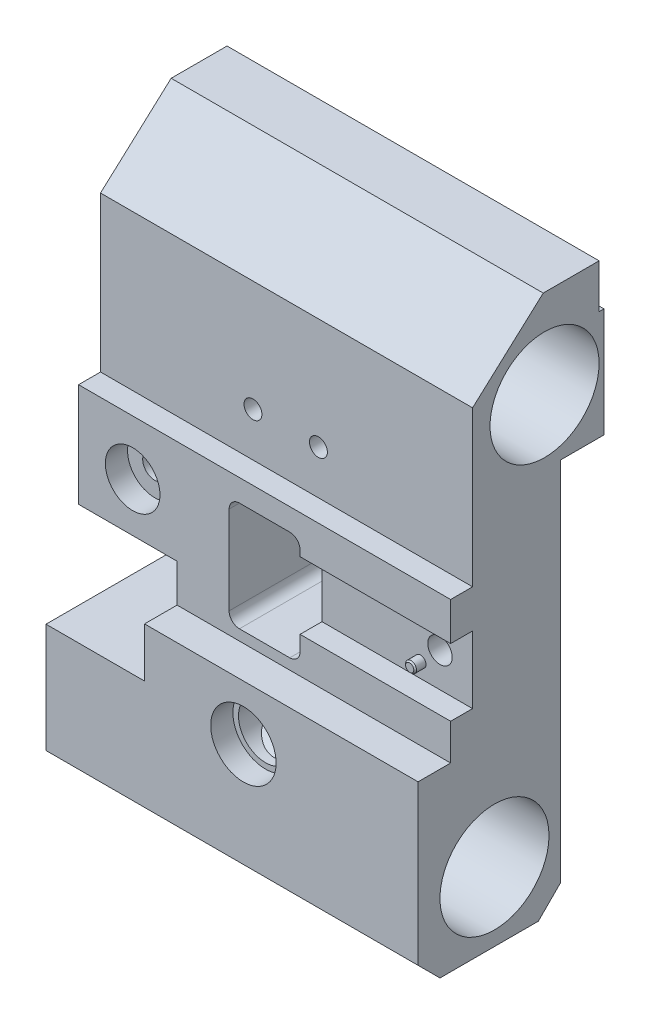
from build123d import *

# Parameters (mm, degrees)
BOSS_EXTRUDE1_DEPTH      = 54
BOSS_EXTRUDE1_DEPTH_BACK = 54
SKETCH1_R                = 15.83
SKETCH2_R                = 7.875
SKETCH2_R_2              = 2.6
SKETCH2_R_3              = 3.525
SKETCH2_R_4              = 3.55
SKETCH2_W                = 28.6
SKETCH2_H                = 25.4
CUT_EXTRUDE1_DEPTH       = 154.113939274
SKETCH3_W                = 43.7
SKETCH3_H                = 19.52
CUT_EXTRUDE2_DEPTH       = 6.36
SKETCH4_R                = 1.585
BOSS_EXTRUDE2_DEPTH      = 3.15
SKETCH10_R               = 1.585
CUT_EXTRUDE6_DEPTH       = 20
SKETCH11_R               = 5.5
SKETCH11_R_2             = 3.525
SKETCH11_R_3             = 5.42
CUT_EXTRUDE7_DEPTH       = 6.56
CHAMFER1_SIZE            = 0.4
SKETCH5_R                = 7.925
CUT_EXTRUDE3_DEPTH       = 6.44
SKETCH6_R                = 9.495
CUT_EXTRUDE4_DEPTH       = 6.44
SKETCH7_W                = 8.77
SKETCH7_H                = 34.96
BOSS_EXTRUDE3_DEPTH      = 3.1
SKETCH8_R                = 2
CUT_EXTRUDE5_DEPTH       = 15
SKETCH11_3_R             = 4.55
SKETCH11_3_R_2           = 2.6
CUT_EXTRUDE8_DEPTH       = 5.45
SKETCH12_R               = 9.475
CUT_EXTRUDE9_DEPTH       = 5.15
SKETCH13_R               = 2
CUT_EXTRUDE10_DEPTH      = 10
SKETCH14_R               = 2
CUT_EXTRUDE11_DEPTH      = 10


with BuildPart() as part:
    # Sketch1 → Boss-Extrude1 (new, two sides: drawn at the far end of the back side and taken through both)
    with BuildSketch(Plane(origin=(0, 0, 0), x_dir=(0, 0, -1), z_dir=(1, 0, 0)).offset(-BOSS_EXTRUDE1_DEPTH_BACK)):
        Polygon((14.15, 137.2), (30.37, 137.2), (30.37, 124.41), (31.79, 124.41), (31.79, 92.72), (19.1, 92.72), (19.1, -13.636038969), (12.736038969, -20), (-15.816038969, -20), (-22.18, -13.636038969), (-22.18, 32.5), (-12.73, 32.5), (-12.73, 73.61), (-6.36, 73.61), (-6.36, 118.61), align=None)
        Circle(SKETCH1_R, mode=Mode.SUBTRACT)
        with Locations((14.54, 111.46)):
            Circle(SKETCH1_R, mode=Mode.SUBTRACT)
    extrude(amount=BOSS_EXTRUDE1_DEPTH + BOSS_EXTRUDE1_DEPTH_BACK)

    # Sketch2 → Cut-Extrude1 (cut, through all)
    with BuildSketch(Plane(origin=(0, 0, -19.1), x_dir=(-1, 0, 0), z_dir=(0, 0, -1))):
        with Locations((-3.3, 16.595)):
            Circle(SKETCH2_R)
        with Locations((-9.25, 86.37)):
            Circle(SKETCH2_R_2)
        with Locations((9.75, 86.37)):
            Circle(SKETCH2_R_2)
        with Locations((38.3, 57.72)):
            Circle(SKETCH2_R_3)
        with Locations((-44.55, 52.92)):
            Circle(SKETCH2_R_4)
        with BuildLine():
            Line((-7.3, 67.2), (7.3, 67.2))
            ThreePointArc((7.3, 67.2), (9.421320344, 66.321320344), (10.3, 64.2))
            Line((10.3, 64.2), (10.3, 38.6))
            ThreePointArc((10.3, 38.6), (9.421320344, 36.478679656), (7.3, 35.6))
            Line((7.3, 35.6), (-7.3, 35.6))
            ThreePointArc((-7.3, 35.6), (-9.421320344, 36.478679656), (-10.3, 38.6))
            Line((-10.3, 38.6), (-10.3, 64.2))
            ThreePointArc((-10.3, 64.2), (-9.421320344, 66.321320344), (-7.3, 67.2))
        make_face()
        with Locations((39.7, 30.83)):
            Rectangle(SKETCH2_W, SKETCH2_H)
    extrude(amount=-CUT_EXTRUDE1_DEPTH, mode=Mode.SUBTRACT)

    # Sketch3 → Cut-Extrude2 (cut)
    with BuildSketch(Plane.XY.offset(12.73)):
        with Locations((32.15, 52.76)):
            Rectangle(SKETCH3_W, SKETCH3_H)
    extrude(amount=-CUT_EXTRUDE2_DEPTH, mode=Mode.SUBTRACT)

    # Sketch4 → Boss-Extrude2 (add)
    with BuildSketch(Plane.XY.offset(6.37)):
        with Locations((38.915, 47.335)):
            Circle(SKETCH4_R)
    extrude(amount=BOSS_EXTRUDE2_DEPTH)

    # Sketch10 → Cut-Extrude6 (cut)
    with BuildSketch(Plane(origin=(0, 0, -19.1), x_dir=(-1, 0, 0), z_dir=(0, 0, -1))):
        with Locations((-38.915, 47.335)):
            Circle(SKETCH10_R)
    extrude(amount=-CUT_EXTRUDE6_DEPTH, mode=Mode.SUBTRACT)

    # Sketch11 → Cut-Extrude7 (cut)
    # profile 1 of 2: a face of its own
    with BuildSketch(Plane(origin=(0, 0, -19.1), x_dir=(-1, 0, 0), z_dir=(0, 0, -1))):
        with Locations((38.3, 57.72)):
            Circle(SKETCH11_R)
        with Locations((38.3, 57.72)):
            Circle(SKETCH11_R_2, mode=Mode.SUBTRACT)
    # profile 2 of 2: a face of its own
    with BuildSketch(Plane(origin=(0, 0, -19.1), x_dir=(-1, 0, 0), z_dir=(0, 0, -1))):
        with Locations((-44.55, 52.92)):
            Circle(SKETCH11_R_3)
    extrude(amount=-CUT_EXTRUDE7_DEPTH, mode=Mode.SUBTRACT)

    # Chamfer1
    chamfer1_edges = [part.edges().sort_by_distance(p)[0] for p in [
        (37.33, 47.335, 9.52),
    ]]
    chamfer(chamfer1_edges, length=CHAMFER1_SIZE)

    # Sketch5 → Cut-Extrude3 (cut)
    with BuildSketch(Plane.XY.offset(12.73)):
        with Locations((-38.3, 57.72)):
            Circle(SKETCH5_R)
    extrude(amount=-CUT_EXTRUDE3_DEPTH, mode=Mode.SUBTRACT)

    # Sketch6 → Cut-Extrude4 (cut)
    with BuildSketch(Plane.XY.offset(22.18)):
        with Locations((3.3, 16.595)):
            Circle(SKETCH6_R)
    extrude(amount=-CUT_EXTRUDE4_DEPTH, mode=Mode.SUBTRACT)

    # Sketch7 → Boss-Extrude3 (add)
    with BuildSketch(Plane(origin=(0, 0, -19.1), x_dir=(-1, 0, 0), z_dir=(0, 0, -1))):
        with Locations((21.015, 16.59)):
            Rectangle(SKETCH7_W, SKETCH7_H)
    extrude(amount=BOSS_EXTRUDE3_DEPTH)

    # Sketch8 → Cut-Extrude5 (cut)
    with BuildSketch(Plane(origin=(0, 0, -22.2), x_dir=(-1, 0, 0), z_dir=(0, 0, -1))):
        with Locations((21.4, 29.135)):
            Circle(SKETCH8_R)
        with Locations((21.4, 3.82)):
            Circle(SKETCH8_R)
    extrude(amount=-CUT_EXTRUDE5_DEPTH, mode=Mode.SUBTRACT)

    # Sketch11<3> → Cut-Extrude8 (cut)
    # profile 1 of 2: a face of its own
    with BuildSketch(Plane(origin=(0, 0, -19.1), x_dir=(-1, 0, 0), z_dir=(0, 0, -1))):
        with Locations((-9.25, 86.37)):
            Circle(SKETCH11_3_R)
        with Locations((-9.25, 86.37)):
            Circle(SKETCH11_3_R_2, mode=Mode.SUBTRACT)
    # profile 2 of 2: a face of its own
    with BuildSketch(Plane(origin=(0, 0, -19.1), x_dir=(-1, 0, 0), z_dir=(0, 0, -1))):
        with Locations((9.75, 86.37)):
            Circle(SKETCH11_3_R)
        with Locations((9.75, 86.37)):
            Circle(SKETCH11_3_R_2, mode=Mode.SUBTRACT)
    extrude(amount=-CUT_EXTRUDE8_DEPTH, mode=Mode.SUBTRACT)

    # Sketch12 → Cut-Extrude9 (cut)
    with BuildSketch(Plane(origin=(0, 0, -19.1), x_dir=(-1, 0, 0), z_dir=(0, 0, -1))):
        with Locations((-3.3, 16.595)):
            Circle(SKETCH12_R)
    extrude(amount=-CUT_EXTRUDE9_DEPTH, mode=Mode.SUBTRACT)

    # Sketch13 → Cut-Extrude10 (cut)
    with BuildSketch(Plane(origin=(0, 0, -19.1), x_dir=(-1, 0, 0), z_dir=(0, 0, -1))):
        with Locations((-13.5, 73.72)):
            Circle(SKETCH13_R)
        with Locations((13.2, 73.72)):
            Circle(SKETCH13_R)
        with Locations((-13.5, 41.72)):
            Circle(SKETCH13_R)
        with Locations((13.2, 41.72)):
            Circle(SKETCH13_R)
        with Locations((20.3, 41.72)):
            Circle(SKETCH13_R)
        with Locations((-21, 41.92)):
            Circle(SKETCH13_R)
    extrude(amount=-CUT_EXTRUDE10_DEPTH, mode=Mode.SUBTRACT)

    # Sketch14 → Cut-Extrude11 (cut)
    with BuildSketch(Plane(origin=(0, 0, -30.37), x_dir=(-1, 0, 0), z_dir=(0, 0, -1))):
        with Locations((-0.2, 130.91)):
            Circle(SKETCH14_R)
    extrude(amount=-CUT_EXTRUDE11_DEPTH, mode=Mode.SUBTRACT)


solid = part.part
